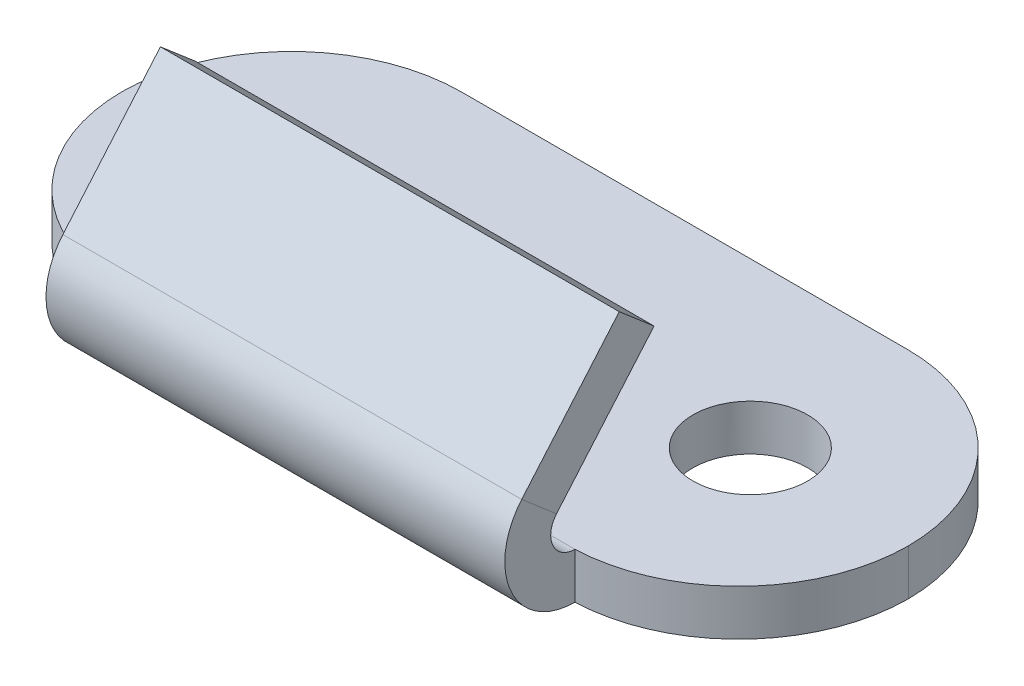
from build123d import *

# Parameters (mm, degrees)
T_LE_DE_BASE_PLI_E1_DEPTH = 12
ENL_V_START               = 7
ENL_V_MAT_EXTRU_1_DEPTH   = 5
ESQUISSE7_R               = 1.75
ENL_V_MAT_EXTRU_2_DEPTH   = 10
CONG_1_R                  = 5.2


# Read off the part's stored shape, not the designer's step: Enlèv. mat.-Extru.1
# Sheet-metal steps are written as plain solids
with BuildPart() as part:
    # Esquisse1 → Tôle de base pliée1 (new body)
    with BuildSketch(Plane(origin=(0, 0, 0), x_dir=(0, 0, -1), z_dir=(1, 0, 0))):
        with BuildLine():
            Line((0, 0), (-10.354560188, 0))
            ThreePointArc((-10.354560188, 0), (-12.295688846, 1.243807141), (-11.976787844, 3.527080849))
            Line((-11.976787844, 3.527080849), (-9, 7))
            Line((-9, 7), (-7.937040757, 6.088892077))
            Line((-7.937040757, 6.088892077), (-10.913828601, 2.615972926))
            ThreePointArc((-10.913828601, 2.615972926), (-11.023770789, 1.828806674), (-10.354560188, 1.4))
            Line((-10.354560188, 1.4), (0, 1.4))
            Line((0, 1.4), (0, 0))
        make_face()
    extrude(amount=T_LE_DE_BASE_PLI_E1_DEPTH)

    # Enlèv. mat.-Extru.1 outline → Enlèv. mat.-Extru.1 (cut)
    with BuildSketch(Plane.YZ.offset(ENL_V_START)):
        with BuildLine():
            Line((0, 10.354560188), (1.4, 10.354560188))
            ThreePointArc((1.4, 10.354560188), (1.828806674, 11.023770789), (2.615972926, 10.913828601))
            Line((2.615972926, 10.913828601), (6.088892077, 7.937040757))
            Line((6.088892077, 7.937040757), (7, 9))
            Line((7, 9), (3.527080849, 11.976787844))
            ThreePointArc((3.527080849, 11.976787844), (1.243807141, 12.295688846), (0, 10.354560188))
        make_face()
    extrude(amount=ENL_V_MAT_EXTRU_1_DEPTH, mode=Mode.SUBTRACT)

    # Esquisse7 → Enlèv. mat.-Extru.2 (cut)
    with BuildSketch(Plane(origin=(0, 1.4, 0), x_dir=(1, 0, 0), z_dir=(0, 1, 0))):
        with Locations(Location((7, -5, 0), (0, 0, 270))):
            Circle(ESQUISSE7_R)
    extrude(amount=-ENL_V_MAT_EXTRU_2_DEPTH, mode=Mode.SUBTRACT)

    # Congé1
    # the kernel refuses this fillet: 5.2 mm, written as the material it takes off along each edge
    with BuildSketch(Plane(origin=(12, -12.990381057, 10.354560188), x_dir=(-1, 0, 0), z_dir=(0, 1, 0))) as cong_1_piece_1:
        with BuildLine():
            CenterArc((5.2, -5.196152423), CONG_1_R, 92.204227504, 87.795772496)
            Line((0, -5.196152423), (-0.104, -5.196152423))
            Line((-0.104, -5.196152423), (-0.104, 0))
            Line((-0.104, 0), (0, 0.104))
            ThreePointArc((0, 0.104), (2.5, 0.104), (4.996, 0.103923048))
            Line((4.996, 0.103923048), (5, 0))
        make_face()
    extrude(amount=27.380762114, mode=Mode.SUBTRACT)
    with BuildSketch(Plane(origin=(12, 14.4, 0), x_dir=(-1, 0, 0), z_dir=(0, -1, 0))) as cong_1_piece_2:
        with BuildLine():
            CenterArc((CONG_1_R, -CONG_1_R), CONG_1_R, 90, 90)
            Line((0, -CONG_1_R), (-CONG_1_R * 0.02, -CONG_1_R))
            Line((-CONG_1_R * 0.02, -CONG_1_R), (-CONG_1_R * 0.02, CONG_1_R * 0.02))
            Line((-CONG_1_R * 0.02, CONG_1_R * 0.02), (CONG_1_R, CONG_1_R * 0.02))
            Line((CONG_1_R, CONG_1_R * 0.02), (CONG_1_R, 0))
        make_face()
    extrude(amount=27.4, mode=Mode.SUBTRACT)

    # Symétrie1: part across plane


with BuildPart() as part_1:
    add(part.part)
    add(part.part.mirror(Plane(origin=(0, 2.615972926, 10.913828601), x_dir=(0, 0, 1), z_dir=(-1, 0, 0))))


solid = part_1.part
